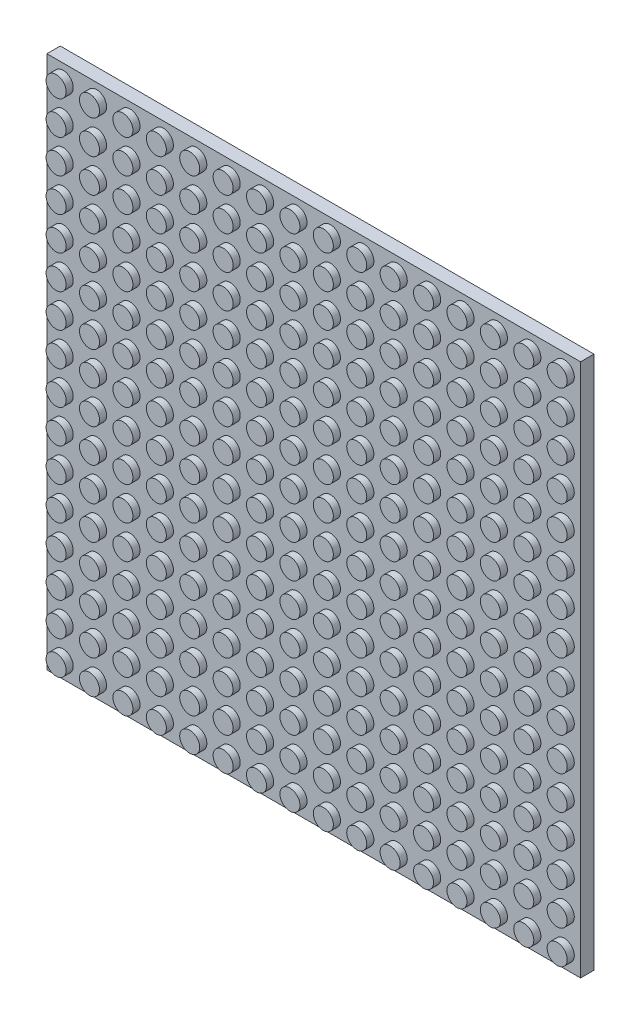
from build123d import *

# Parameters (mm, degrees)
SKETCH_1_W          = 127.8
SKETCH_1_H          = 127.8
EXTRUDE_1_DEPTH     = 3.2
SKETCH_2_R          = 2.4
EXTRUDE_2_DEPTH     = 1.7
SKETCH_5_R          = 2.5
CUT_EXTRUDE_1_DEPTH = 1.8


with BuildPart() as part:
    # Эскиз1 → Бобышка-Вытянуть1 (new body)
    with BuildSketch(Plane.XY):
        Rectangle(SKETCH_1_W, SKETCH_1_H)
    extrude(amount=EXTRUDE_1_DEPTH)

    # Эскиз2 → Бобышка-Вытянуть2 (add)
    with BuildSketch(Plane.XY.offset(3.2)):
        with Locations((-60, 60)):
            Circle(SKETCH_2_R)
        with Locations((-52, 60)):
            Circle(SKETCH_2_R)
        with Locations((-44, 60)):
            Circle(SKETCH_2_R)
        with Locations((-36, 60)):
            Circle(SKETCH_2_R)
        with Locations((-28, 60)):
            Circle(SKETCH_2_R)
        with Locations((-20, 60)):
            Circle(SKETCH_2_R)
        with Locations((-12, 60)):
            Circle(SKETCH_2_R)
        with Locations((-4, 60)):
            Circle(SKETCH_2_R)
        with Locations((4, 60)):
            Circle(SKETCH_2_R)
        with Locations((12, 60)):
            Circle(SKETCH_2_R)
        with Locations((20, 60)):
            Circle(SKETCH_2_R)
        with Locations((28, 60)):
            Circle(SKETCH_2_R)
        with Locations((36, 60)):
            Circle(SKETCH_2_R)
        with Locations((44, 60)):
            Circle(SKETCH_2_R)
        with Locations((52, 60)):
            Circle(SKETCH_2_R)
        with Locations((60, 60)):
            Circle(SKETCH_2_R)
        with Locations((-52, 52)):
            Circle(SKETCH_2_R)
        with Locations((-44, 52)):
            Circle(SKETCH_2_R)
        with Locations((-36, 52)):
            Circle(SKETCH_2_R)
        with Locations((-28, 52)):
            Circle(SKETCH_2_R)
        with Locations((-20, 52)):
            Circle(SKETCH_2_R)
        with Locations((-12, 52)):
            Circle(SKETCH_2_R)
        with Locations((-4, 52)):
            Circle(SKETCH_2_R)
        with Locations((4, 52)):
            Circle(SKETCH_2_R)
        with Locations((12, 52)):
            Circle(SKETCH_2_R)
        with Locations((20, 52)):
            Circle(SKETCH_2_R)
        with Locations((28, 52)):
            Circle(SKETCH_2_R)
        with Locations((36, 52)):
            Circle(SKETCH_2_R)
        with Locations((44, 52)):
            Circle(SKETCH_2_R)
        with Locations((52, 52)):
            Circle(SKETCH_2_R)
        with Locations((60, 52)):
            Circle(SKETCH_2_R)
        with Locations((-52, 44)):
            Circle(SKETCH_2_R)
        with Locations((-44, 44)):
            Circle(SKETCH_2_R)
        with Locations((-36, 44)):
            Circle(SKETCH_2_R)
        with Locations((-28, 44)):
            Circle(SKETCH_2_R)
        with Locations((-20, 44)):
            Circle(SKETCH_2_R)
        with Locations((-12, 44)):
            Circle(SKETCH_2_R)
        with Locations((-4, 44)):
            Circle(SKETCH_2_R)
        with Locations((4, 44)):
            Circle(SKETCH_2_R)
        with Locations((12, 44)):
            Circle(SKETCH_2_R)
        with Locations((20, 44)):
            Circle(SKETCH_2_R)
        with Locations((28, 44)):
            Circle(SKETCH_2_R)
        with Locations((36, 44)):
            Circle(SKETCH_2_R)
        with Locations((44, 44)):
            Circle(SKETCH_2_R)
        with Locations((52, 44)):
            Circle(SKETCH_2_R)
        with Locations((60, 44)):
            Circle(SKETCH_2_R)
        with Locations((-52, 36)):
            Circle(SKETCH_2_R)
        with Locations((-44, 36)):
            Circle(SKETCH_2_R)
        with Locations((-36, 36)):
            Circle(SKETCH_2_R)
        with Locations((-28, 36)):
            Circle(SKETCH_2_R)
        with Locations((-20, 36)):
            Circle(SKETCH_2_R)
        with Locations((-12, 36)):
            Circle(SKETCH_2_R)
        with Locations((-4, 36)):
            Circle(SKETCH_2_R)
        with Locations((4, 36)):
            Circle(SKETCH_2_R)
        with Locations((12, 36)):
            Circle(SKETCH_2_R)
        with Locations((20, 36)):
            Circle(SKETCH_2_R)
        with Locations((28, 36)):
            Circle(SKETCH_2_R)
        with Locations((36, 36)):
            Circle(SKETCH_2_R)
        with Locations((44, 36)):
            Circle(SKETCH_2_R)
        with Locations((52, 36)):
            Circle(SKETCH_2_R)
        with Locations((60, 36)):
            Circle(SKETCH_2_R)
        with Locations((-52, 28)):
            Circle(SKETCH_2_R)
        with Locations((-44, 28)):
            Circle(SKETCH_2_R)
        with Locations((-36, 28)):
            Circle(SKETCH_2_R)
        with Locations((-28, 28)):
            Circle(SKETCH_2_R)
        with Locations((-20, 28)):
            Circle(SKETCH_2_R)
        with Locations((-12, 28)):
            Circle(SKETCH_2_R)
        with Locations((-4, 28)):
            Circle(SKETCH_2_R)
        with Locations((4, 28)):
            Circle(SKETCH_2_R)
        with Locations((12, 28)):
            Circle(SKETCH_2_R)
        with Locations((20, 28)):
            Circle(SKETCH_2_R)
        with Locations((28, 28)):
            Circle(SKETCH_2_R)
        with Locations((36, 28)):
            Circle(SKETCH_2_R)
        with Locations((44, 28)):
            Circle(SKETCH_2_R)
        with Locations((52, 28)):
            Circle(SKETCH_2_R)
        with Locations((60, 28)):
            Circle(SKETCH_2_R)
        with Locations((-52, 20)):
            Circle(SKETCH_2_R)
        with Locations((-44, 20)):
            Circle(SKETCH_2_R)
        with Locations((-36, 20)):
            Circle(SKETCH_2_R)
        with Locations((-28, 20)):
            Circle(SKETCH_2_R)
        with Locations((-20, 20)):
            Circle(SKETCH_2_R)
        with Locations((-12, 20)):
            Circle(SKETCH_2_R)
        with Locations((-4, 20)):
            Circle(SKETCH_2_R)
        with Locations((4, 20)):
            Circle(SKETCH_2_R)
        with Locations((12, 20)):
            Circle(SKETCH_2_R)
        with Locations((20, 20)):
            Circle(SKETCH_2_R)
        with Locations((28, 20)):
            Circle(SKETCH_2_R)
        with Locations((36, 20)):
            Circle(SKETCH_2_R)
        with Locations((44, 20)):
            Circle(SKETCH_2_R)
        with Locations((52, 20)):
            Circle(SKETCH_2_R)
        with Locations((60, 20)):
            Circle(SKETCH_2_R)
        with Locations((-52, 12)):
            Circle(SKETCH_2_R)
        with Locations((-44, 12)):
            Circle(SKETCH_2_R)
        with Locations((-36, 12)):
            Circle(SKETCH_2_R)
        with Locations((-28, 12)):
            Circle(SKETCH_2_R)
        with Locations((-20, 12)):
            Circle(SKETCH_2_R)
        with Locations((-12, 12)):
            Circle(SKETCH_2_R)
        with Locations((-4, 12)):
            Circle(SKETCH_2_R)
        with Locations((4, 12)):
            Circle(SKETCH_2_R)
        with Locations((12, 12)):
            Circle(SKETCH_2_R)
        with Locations((20, 12)):
            Circle(SKETCH_2_R)
        with Locations((28, 12)):
            Circle(SKETCH_2_R)
        with Locations((36, 12)):
            Circle(SKETCH_2_R)
        with Locations((44, 12)):
            Circle(SKETCH_2_R)
        with Locations((52, 12)):
            Circle(SKETCH_2_R)
        with Locations((60, 12)):
            Circle(SKETCH_2_R)
        with Locations((-52, 4)):
            Circle(SKETCH_2_R)
        with Locations((-44, 4)):
            Circle(SKETCH_2_R)
        with Locations((-36, 4)):
            Circle(SKETCH_2_R)
        with Locations((-28, 4)):
            Circle(SKETCH_2_R)
        with Locations((-20, 4)):
            Circle(SKETCH_2_R)
        with Locations((-12, 4)):
            Circle(SKETCH_2_R)
        with Locations((-4, 4)):
            Circle(SKETCH_2_R)
        with Locations((4, 4)):
            Circle(SKETCH_2_R)
        with Locations((12, 4)):
            Circle(SKETCH_2_R)
        with Locations((20, 4)):
            Circle(SKETCH_2_R)
        with Locations((28, 4)):
            Circle(SKETCH_2_R)
        with Locations((36, 4)):
            Circle(SKETCH_2_R)
        with Locations((44, 4)):
            Circle(SKETCH_2_R)
        with Locations((52, 4)):
            Circle(SKETCH_2_R)
        with Locations((60, 4)):
            Circle(SKETCH_2_R)
        with Locations((-52, -4)):
            Circle(SKETCH_2_R)
        with Locations((-44, -4)):
            Circle(SKETCH_2_R)
        with Locations((-36, -4)):
            Circle(SKETCH_2_R)
        with Locations((-28, -4)):
            Circle(SKETCH_2_R)
        with Locations((-20, -4)):
            Circle(SKETCH_2_R)
        with Locations((-12, -4)):
            Circle(SKETCH_2_R)
        with Locations((-4, -4)):
            Circle(SKETCH_2_R)
        with Locations((4, -4)):
            Circle(SKETCH_2_R)
        with Locations((12, -4)):
            Circle(SKETCH_2_R)
        with Locations((20, -4)):
            Circle(SKETCH_2_R)
        with Locations((28, -4)):
            Circle(SKETCH_2_R)
        with Locations((36, -4)):
            Circle(SKETCH_2_R)
        with Locations((44, -4)):
            Circle(SKETCH_2_R)
        with Locations((52, -4)):
            Circle(SKETCH_2_R)
        with Locations((60, -4)):
            Circle(SKETCH_2_R)
        with Locations((-52, -12)):
            Circle(SKETCH_2_R)
        with Locations((-44, -12)):
            Circle(SKETCH_2_R)
        with Locations((-36, -12)):
            Circle(SKETCH_2_R)
        with Locations((-28, -12)):
            Circle(SKETCH_2_R)
        with Locations((-20, -12)):
            Circle(SKETCH_2_R)
        with Locations((-12, -12)):
            Circle(SKETCH_2_R)
        with Locations((-4, -12)):
            Circle(SKETCH_2_R)
        with Locations((4, -12)):
            Circle(SKETCH_2_R)
        with Locations((12, -12)):
            Circle(SKETCH_2_R)
        with Locations((20, -12)):
            Circle(SKETCH_2_R)
        with Locations((28, -12)):
            Circle(SKETCH_2_R)
        with Locations((36, -12)):
            Circle(SKETCH_2_R)
        with Locations((44, -12)):
            Circle(SKETCH_2_R)
        with Locations((52, -12)):
            Circle(SKETCH_2_R)
        with Locations((60, -12)):
            Circle(SKETCH_2_R)
        with Locations((-52, -20)):
            Circle(SKETCH_2_R)
        with Locations((-44, -20)):
            Circle(SKETCH_2_R)
        with Locations((-36, -20)):
            Circle(SKETCH_2_R)
        with Locations((-28, -20)):
            Circle(SKETCH_2_R)
        with Locations((-20, -20)):
            Circle(SKETCH_2_R)
        with Locations((-12, -20)):
            Circle(SKETCH_2_R)
        with Locations((-4, -20)):
            Circle(SKETCH_2_R)
        with Locations((4, -20)):
            Circle(SKETCH_2_R)
        with Locations((12, -20)):
            Circle(SKETCH_2_R)
        with Locations((20, -20)):
            Circle(SKETCH_2_R)
        with Locations((28, -20)):
            Circle(SKETCH_2_R)
        with Locations((36, -20)):
            Circle(SKETCH_2_R)
        with Locations((44, -20)):
            Circle(SKETCH_2_R)
        with Locations((52, -20)):
            Circle(SKETCH_2_R)
        with Locations((60, -20)):
            Circle(SKETCH_2_R)
        with Locations((-52, -28)):
            Circle(SKETCH_2_R)
        with Locations((-44, -28)):
            Circle(SKETCH_2_R)
        with Locations((-36, -28)):
            Circle(SKETCH_2_R)
        with Locations((-28, -28)):
            Circle(SKETCH_2_R)
        with Locations((-20, -28)):
            Circle(SKETCH_2_R)
        with Locations((-12, -28)):
            Circle(SKETCH_2_R)
        with Locations((-4, -28)):
            Circle(SKETCH_2_R)
        with Locations((4, -28)):
            Circle(SKETCH_2_R)
        with Locations((12, -28)):
            Circle(SKETCH_2_R)
        with Locations((20, -28)):
            Circle(SKETCH_2_R)
        with Locations((28, -28)):
            Circle(SKETCH_2_R)
        with Locations((36, -28)):
            Circle(SKETCH_2_R)
        with Locations((44, -28)):
            Circle(SKETCH_2_R)
        with Locations((52, -28)):
            Circle(SKETCH_2_R)
        with Locations((60, -28)):
            Circle(SKETCH_2_R)
        with Locations((-52, -36)):
            Circle(SKETCH_2_R)
        with Locations((-44, -36)):
            Circle(SKETCH_2_R)
        with Locations((-36, -36)):
            Circle(SKETCH_2_R)
        with Locations((-28, -36)):
            Circle(SKETCH_2_R)
        with Locations((-20, -36)):
            Circle(SKETCH_2_R)
        with Locations((-12, -36)):
            Circle(SKETCH_2_R)
        with Locations((-4, -36)):
            Circle(SKETCH_2_R)
        with Locations((4, -36)):
            Circle(SKETCH_2_R)
        with Locations((12, -36)):
            Circle(SKETCH_2_R)
        with Locations((20, -36)):
            Circle(SKETCH_2_R)
        with Locations((28, -36)):
            Circle(SKETCH_2_R)
        with Locations((36, -36)):
            Circle(SKETCH_2_R)
        with Locations((44, -36)):
            Circle(SKETCH_2_R)
        with Locations((52, -36)):
            Circle(SKETCH_2_R)
        with Locations((60, -36)):
            Circle(SKETCH_2_R)
        with Locations((-52, -44)):
            Circle(SKETCH_2_R)
        with Locations((-44, -44)):
            Circle(SKETCH_2_R)
        with Locations((-36, -44)):
            Circle(SKETCH_2_R)
        with Locations((-28, -44)):
            Circle(SKETCH_2_R)
        with Locations((-20, -44)):
            Circle(SKETCH_2_R)
        with Locations((-12, -44)):
            Circle(SKETCH_2_R)
        with Locations((-4, -44)):
            Circle(SKETCH_2_R)
        with Locations((4, -44)):
            Circle(SKETCH_2_R)
        with Locations((12, -44)):
            Circle(SKETCH_2_R)
        with Locations((20, -44)):
            Circle(SKETCH_2_R)
        with Locations((28, -44)):
            Circle(SKETCH_2_R)
        with Locations((36, -44)):
            Circle(SKETCH_2_R)
        with Locations((44, -44)):
            Circle(SKETCH_2_R)
        with Locations((52, -44)):
            Circle(SKETCH_2_R)
        with Locations((60, -44)):
            Circle(SKETCH_2_R)
        with Locations((-52, -52)):
            Circle(SKETCH_2_R)
        with Locations((-44, -52)):
            Circle(SKETCH_2_R)
        with Locations((-36, -52)):
            Circle(SKETCH_2_R)
        with Locations((-28, -52)):
            Circle(SKETCH_2_R)
        with Locations((-20, -52)):
            Circle(SKETCH_2_R)
        with Locations((-12, -52)):
            Circle(SKETCH_2_R)
        with Locations((-4, -52)):
            Circle(SKETCH_2_R)
        with Locations((4, -52)):
            Circle(SKETCH_2_R)
        with Locations((12, -52)):
            Circle(SKETCH_2_R)
        with Locations((20, -52)):
            Circle(SKETCH_2_R)
        with Locations((28, -52)):
            Circle(SKETCH_2_R)
        with Locations((36, -52)):
            Circle(SKETCH_2_R)
        with Locations((44, -52)):
            Circle(SKETCH_2_R)
        with Locations((52, -52)):
            Circle(SKETCH_2_R)
        with Locations((60, -52)):
            Circle(SKETCH_2_R)
        with Locations((-52, -60)):
            Circle(SKETCH_2_R)
        with Locations((-44, -60)):
            Circle(SKETCH_2_R)
        with Locations((-36, -60)):
            Circle(SKETCH_2_R)
        with Locations((-28, -60)):
            Circle(SKETCH_2_R)
        with Locations((-20, -60)):
            Circle(SKETCH_2_R)
        with Locations((-12, -60)):
            Circle(SKETCH_2_R)
        with Locations((-4, -60)):
            Circle(SKETCH_2_R)
        with Locations((4, -60)):
            Circle(SKETCH_2_R)
        with Locations((12, -60)):
            Circle(SKETCH_2_R)
        with Locations((20, -60)):
            Circle(SKETCH_2_R)
        with Locations((28, -60)):
            Circle(SKETCH_2_R)
        with Locations((36, -60)):
            Circle(SKETCH_2_R)
        with Locations((44, -60)):
            Circle(SKETCH_2_R)
        with Locations((52, -60)):
            Circle(SKETCH_2_R)
        with Locations((60, -60)):
            Circle(SKETCH_2_R)
        with Locations((-60, 52)):
            Circle(SKETCH_2_R)
        with Locations((-60, 44)):
            Circle(SKETCH_2_R)
        with Locations((-60, 36)):
            Circle(SKETCH_2_R)
        with Locations((-60, 28)):
            Circle(SKETCH_2_R)
        with Locations((-60, 20)):
            Circle(SKETCH_2_R)
        with Locations((-60, 12)):
            Circle(SKETCH_2_R)
        with Locations((-60, 4)):
            Circle(SKETCH_2_R)
        with Locations((-60, -4)):
            Circle(SKETCH_2_R)
        with Locations((-60, -12)):
            Circle(SKETCH_2_R)
        with Locations((-60, -20)):
            Circle(SKETCH_2_R)
        with Locations((-60, -28)):
            Circle(SKETCH_2_R)
        with Locations((-60, -36)):
            Circle(SKETCH_2_R)
        with Locations((-60, -44)):
            Circle(SKETCH_2_R)
        with Locations((-60, -52)):
            Circle(SKETCH_2_R)
        with Locations((-60, -60)):
            Circle(SKETCH_2_R)
    extrude(amount=EXTRUDE_2_DEPTH)

    # Эскиз5 → Вырез-Вытянуть1 (cut)
    with BuildSketch(Plane(origin=(0, 0, 0), x_dir=(-1, 0, 0), z_dir=(0, 0, -1))):
        with Locations((-60, 60)):
            Circle(SKETCH_5_R)
        with Locations((-52, 60)):
            Circle(SKETCH_5_R)
        with Locations((-44, 60)):
            Circle(SKETCH_5_R)
        with Locations((-36, 60)):
            Circle(SKETCH_5_R)
        with Locations((-28, 60)):
            Circle(SKETCH_5_R)
        with Locations((-20, 60)):
            Circle(SKETCH_5_R)
        with Locations((-12, 60)):
            Circle(SKETCH_5_R)
        with Locations((-4, 60)):
            Circle(SKETCH_5_R)
        with Locations((4, 60)):
            Circle(SKETCH_5_R)
        with Locations((12, 60)):
            Circle(SKETCH_5_R)
        with Locations((20, 60)):
            Circle(SKETCH_5_R)
        with Locations((28, 60)):
            Circle(SKETCH_5_R)
        with Locations((36, 60)):
            Circle(SKETCH_5_R)
        with Locations((44, 60)):
            Circle(SKETCH_5_R)
        with Locations((52, 60)):
            Circle(SKETCH_5_R)
        with Locations((60, 60)):
            Circle(SKETCH_5_R)
        with Locations((-52, 52)):
            Circle(SKETCH_5_R)
        with Locations((-44, 52)):
            Circle(SKETCH_5_R)
        with Locations((-36, 52)):
            Circle(SKETCH_5_R)
        with Locations((-28, 52)):
            Circle(SKETCH_5_R)
        with Locations((-20, 52)):
            Circle(SKETCH_5_R)
        with Locations((-12, 52)):
            Circle(SKETCH_5_R)
        with Locations((-4, 52)):
            Circle(SKETCH_5_R)
        with Locations((4, 52)):
            Circle(SKETCH_5_R)
        with Locations((12, 52)):
            Circle(SKETCH_5_R)
        with Locations((20, 52)):
            Circle(SKETCH_5_R)
        with Locations((28, 52)):
            Circle(SKETCH_5_R)
        with Locations((36, 52)):
            Circle(SKETCH_5_R)
        with Locations((44, 52)):
            Circle(SKETCH_5_R)
        with Locations((52, 52)):
            Circle(SKETCH_5_R)
        with Locations((60, 52)):
            Circle(SKETCH_5_R)
        with Locations((-52, 44)):
            Circle(SKETCH_5_R)
        with Locations((-44, 44)):
            Circle(SKETCH_5_R)
        with Locations((-36, 44)):
            Circle(SKETCH_5_R)
        with Locations((-28, 44)):
            Circle(SKETCH_5_R)
        with Locations((-20, 44)):
            Circle(SKETCH_5_R)
        with Locations((-12, 44)):
            Circle(SKETCH_5_R)
        with Locations((-4, 44)):
            Circle(SKETCH_5_R)
        with Locations((4, 44)):
            Circle(SKETCH_5_R)
        with Locations((12, 44)):
            Circle(SKETCH_5_R)
        with Locations((20, 44)):
            Circle(SKETCH_5_R)
        with Locations((28, 44)):
            Circle(SKETCH_5_R)
        with Locations((36, 44)):
            Circle(SKETCH_5_R)
        with Locations((44, 44)):
            Circle(SKETCH_5_R)
        with Locations((52, 44)):
            Circle(SKETCH_5_R)
        with Locations((60, 44)):
            Circle(SKETCH_5_R)
        with Locations((-52, 36)):
            Circle(SKETCH_5_R)
        with Locations((-44, 36)):
            Circle(SKETCH_5_R)
        with Locations((-36, 36)):
            Circle(SKETCH_5_R)
        with Locations((-28, 36)):
            Circle(SKETCH_5_R)
        with Locations((-20, 36)):
            Circle(SKETCH_5_R)
        with Locations((-12, 36)):
            Circle(SKETCH_5_R)
        with Locations((-4, 36)):
            Circle(SKETCH_5_R)
        with Locations((4, 36)):
            Circle(SKETCH_5_R)
        with Locations((12, 36)):
            Circle(SKETCH_5_R)
        with Locations((20, 36)):
            Circle(SKETCH_5_R)
        with Locations((28, 36)):
            Circle(SKETCH_5_R)
        with Locations((36, 36)):
            Circle(SKETCH_5_R)
        with Locations((44, 36)):
            Circle(SKETCH_5_R)
        with Locations((52, 36)):
            Circle(SKETCH_5_R)
        with Locations((60, 36)):
            Circle(SKETCH_5_R)
        with Locations((-52, 28)):
            Circle(SKETCH_5_R)
        with Locations((-44, 28)):
            Circle(SKETCH_5_R)
        with Locations((-36, 28)):
            Circle(SKETCH_5_R)
        with Locations((-28, 28)):
            Circle(SKETCH_5_R)
        with Locations((-20, 28)):
            Circle(SKETCH_5_R)
        with Locations((-12, 28)):
            Circle(SKETCH_5_R)
        with Locations((-4, 28)):
            Circle(SKETCH_5_R)
        with Locations((4, 28)):
            Circle(SKETCH_5_R)
        with Locations((12, 28)):
            Circle(SKETCH_5_R)
        with Locations((20, 28)):
            Circle(SKETCH_5_R)
        with Locations((28, 28)):
            Circle(SKETCH_5_R)
        with Locations((36, 28)):
            Circle(SKETCH_5_R)
        with Locations((44, 28)):
            Circle(SKETCH_5_R)
        with Locations((52, 28)):
            Circle(SKETCH_5_R)
        with Locations((60, 28)):
            Circle(SKETCH_5_R)
        with Locations((-52, 20)):
            Circle(SKETCH_5_R)
        with Locations((-44, 20)):
            Circle(SKETCH_5_R)
        with Locations((-36, 20)):
            Circle(SKETCH_5_R)
        with Locations((-28, 20)):
            Circle(SKETCH_5_R)
        with Locations((-20, 20)):
            Circle(SKETCH_5_R)
        with Locations((-12, 20)):
            Circle(SKETCH_5_R)
        with Locations((-4, 20)):
            Circle(SKETCH_5_R)
        with Locations((4, 20)):
            Circle(SKETCH_5_R)
        with Locations((12, 20)):
            Circle(SKETCH_5_R)
        with Locations((20, 20)):
            Circle(SKETCH_5_R)
        with Locations((28, 20)):
            Circle(SKETCH_5_R)
        with Locations((36, 20)):
            Circle(SKETCH_5_R)
        with Locations((44, 20)):
            Circle(SKETCH_5_R)
        with Locations((52, 20)):
            Circle(SKETCH_5_R)
        with Locations((60, 20)):
            Circle(SKETCH_5_R)
        with Locations((-52, 12)):
            Circle(SKETCH_5_R)
        with Locations((-44, 12)):
            Circle(SKETCH_5_R)
        with Locations((-36, 12)):
            Circle(SKETCH_5_R)
        with Locations((-28, 12)):
            Circle(SKETCH_5_R)
        with Locations((-20, 12)):
            Circle(SKETCH_5_R)
        with Locations((-12, 12)):
            Circle(SKETCH_5_R)
        with Locations((-4, 12)):
            Circle(SKETCH_5_R)
        with Locations((4, 12)):
            Circle(SKETCH_5_R)
        with Locations((12, 12)):
            Circle(SKETCH_5_R)
        with Locations((20, 12)):
            Circle(SKETCH_5_R)
        with Locations((28, 12)):
            Circle(SKETCH_5_R)
        with Locations((36, 12)):
            Circle(SKETCH_5_R)
        with Locations((44, 12)):
            Circle(SKETCH_5_R)
        with Locations((52, 12)):
            Circle(SKETCH_5_R)
        with Locations((60, 12)):
            Circle(SKETCH_5_R)
        with Locations((-52, 4)):
            Circle(SKETCH_5_R)
        with Locations((-44, 4)):
            Circle(SKETCH_5_R)
        with Locations((-36, 4)):
            Circle(SKETCH_5_R)
        with Locations((-28, 4)):
            Circle(SKETCH_5_R)
        with Locations((-20, 4)):
            Circle(SKETCH_5_R)
        with Locations((-12, 4)):
            Circle(SKETCH_5_R)
        with Locations((-4, 4)):
            Circle(SKETCH_5_R)
        with Locations((4, 4)):
            Circle(SKETCH_5_R)
        with Locations((12, 4)):
            Circle(SKETCH_5_R)
        with Locations((20, 4)):
            Circle(SKETCH_5_R)
        with Locations((28, 4)):
            Circle(SKETCH_5_R)
        with Locations((36, 4)):
            Circle(SKETCH_5_R)
        with Locations((44, 4)):
            Circle(SKETCH_5_R)
        with Locations((52, 4)):
            Circle(SKETCH_5_R)
        with Locations((60, 4)):
            Circle(SKETCH_5_R)
        with Locations((-52, -4)):
            Circle(SKETCH_5_R)
        with Locations((-44, -4)):
            Circle(SKETCH_5_R)
        with Locations((-36, -4)):
            Circle(SKETCH_5_R)
        with Locations((-28, -4)):
            Circle(SKETCH_5_R)
        with Locations((-20, -4)):
            Circle(SKETCH_5_R)
        with Locations((-12, -4)):
            Circle(SKETCH_5_R)
        with Locations((-4, -4)):
            Circle(SKETCH_5_R)
        with Locations((4, -4)):
            Circle(SKETCH_5_R)
        with Locations((12, -4)):
            Circle(SKETCH_5_R)
        with Locations((20, -4)):
            Circle(SKETCH_5_R)
        with Locations((28, -4)):
            Circle(SKETCH_5_R)
        with Locations((36, -4)):
            Circle(SKETCH_5_R)
        with Locations((44, -4)):
            Circle(SKETCH_5_R)
        with Locations((52, -4)):
            Circle(SKETCH_5_R)
        with Locations((60, -4)):
            Circle(SKETCH_5_R)
        with Locations((-52, -12)):
            Circle(SKETCH_5_R)
        with Locations((-44, -12)):
            Circle(SKETCH_5_R)
        with Locations((-36, -12)):
            Circle(SKETCH_5_R)
        with Locations((-28, -12)):
            Circle(SKETCH_5_R)
        with Locations((-20, -12)):
            Circle(SKETCH_5_R)
        with Locations((-12, -12)):
            Circle(SKETCH_5_R)
        with Locations((-4, -12)):
            Circle(SKETCH_5_R)
        with Locations((4, -12)):
            Circle(SKETCH_5_R)
        with Locations((12, -12)):
            Circle(SKETCH_5_R)
        with Locations((20, -12)):
            Circle(SKETCH_5_R)
        with Locations((28, -12)):
            Circle(SKETCH_5_R)
        with Locations((36, -12)):
            Circle(SKETCH_5_R)
        with Locations((44, -12)):
            Circle(SKETCH_5_R)
        with Locations((52, -12)):
            Circle(SKETCH_5_R)
        with Locations((60, -12)):
            Circle(SKETCH_5_R)
        with Locations((-52, -20)):
            Circle(SKETCH_5_R)
        with Locations((-44, -20)):
            Circle(SKETCH_5_R)
        with Locations((-36, -20)):
            Circle(SKETCH_5_R)
        with Locations((-28, -20)):
            Circle(SKETCH_5_R)
        with Locations((-20, -20)):
            Circle(SKETCH_5_R)
        with Locations((-12, -20)):
            Circle(SKETCH_5_R)
        with Locations((-4, -20)):
            Circle(SKETCH_5_R)
        with Locations((4, -20)):
            Circle(SKETCH_5_R)
        with Locations((12, -20)):
            Circle(SKETCH_5_R)
        with Locations((20, -20)):
            Circle(SKETCH_5_R)
        with Locations((28, -20)):
            Circle(SKETCH_5_R)
        with Locations((36, -20)):
            Circle(SKETCH_5_R)
        with Locations((44, -20)):
            Circle(SKETCH_5_R)
        with Locations((52, -20)):
            Circle(SKETCH_5_R)
        with Locations((60, -20)):
            Circle(SKETCH_5_R)
        with Locations((-52, -28)):
            Circle(SKETCH_5_R)
        with Locations((-44, -28)):
            Circle(SKETCH_5_R)
        with Locations((-36, -28)):
            Circle(SKETCH_5_R)
        with Locations((-28, -28)):
            Circle(SKETCH_5_R)
        with Locations((-20, -28)):
            Circle(SKETCH_5_R)
        with Locations((-12, -28)):
            Circle(SKETCH_5_R)
        with Locations((-4, -28)):
            Circle(SKETCH_5_R)
        with Locations((4, -28)):
            Circle(SKETCH_5_R)
        with Locations((12, -28)):
            Circle(SKETCH_5_R)
        with Locations((20, -28)):
            Circle(SKETCH_5_R)
        with Locations((28, -28)):
            Circle(SKETCH_5_R)
        with Locations((36, -28)):
            Circle(SKETCH_5_R)
        with Locations((44, -28)):
            Circle(SKETCH_5_R)
        with Locations((52, -28)):
            Circle(SKETCH_5_R)
        with Locations((60, -28)):
            Circle(SKETCH_5_R)
        with Locations((-52, -36)):
            Circle(SKETCH_5_R)
        with Locations((-44, -36)):
            Circle(SKETCH_5_R)
        with Locations((-36, -36)):
            Circle(SKETCH_5_R)
        with Locations((-28, -36)):
            Circle(SKETCH_5_R)
        with Locations((-20, -36)):
            Circle(SKETCH_5_R)
        with Locations((-12, -36)):
            Circle(SKETCH_5_R)
        with Locations((-4, -36)):
            Circle(SKETCH_5_R)
        with Locations((4, -36)):
            Circle(SKETCH_5_R)
        with Locations((12, -36)):
            Circle(SKETCH_5_R)
        with Locations((20, -36)):
            Circle(SKETCH_5_R)
        with Locations((28, -36)):
            Circle(SKETCH_5_R)
        with Locations((36, -36)):
            Circle(SKETCH_5_R)
        with Locations((44, -36)):
            Circle(SKETCH_5_R)
        with Locations((52, -36)):
            Circle(SKETCH_5_R)
        with Locations((60, -36)):
            Circle(SKETCH_5_R)
        with Locations((-52, -44)):
            Circle(SKETCH_5_R)
        with Locations((-44, -44)):
            Circle(SKETCH_5_R)
        with Locations((-36, -44)):
            Circle(SKETCH_5_R)
        with Locations((-28, -44)):
            Circle(SKETCH_5_R)
        with Locations((-20, -44)):
            Circle(SKETCH_5_R)
        with Locations((-12, -44)):
            Circle(SKETCH_5_R)
        with Locations((-4, -44)):
            Circle(SKETCH_5_R)
        with Locations((4, -44)):
            Circle(SKETCH_5_R)
        with Locations((12, -44)):
            Circle(SKETCH_5_R)
        with Locations((20, -44)):
            Circle(SKETCH_5_R)
        with Locations((28, -44)):
            Circle(SKETCH_5_R)
        with Locations((36, -44)):
            Circle(SKETCH_5_R)
        with Locations((44, -44)):
            Circle(SKETCH_5_R)
        with Locations((52, -44)):
            Circle(SKETCH_5_R)
        with Locations((60, -44)):
            Circle(SKETCH_5_R)
        with Locations((-52, -52)):
            Circle(SKETCH_5_R)
        with Locations((-44, -52)):
            Circle(SKETCH_5_R)
        with Locations((-36, -52)):
            Circle(SKETCH_5_R)
        with Locations((-28, -52)):
            Circle(SKETCH_5_R)
        with Locations((-20, -52)):
            Circle(SKETCH_5_R)
        with Locations((-12, -52)):
            Circle(SKETCH_5_R)
        with Locations((-4, -52)):
            Circle(SKETCH_5_R)
        with Locations((4, -52)):
            Circle(SKETCH_5_R)
        with Locations((12, -52)):
            Circle(SKETCH_5_R)
        with Locations((20, -52)):
            Circle(SKETCH_5_R)
        with Locations((28, -52)):
            Circle(SKETCH_5_R)
        with Locations((36, -52)):
            Circle(SKETCH_5_R)
        with Locations((44, -52)):
            Circle(SKETCH_5_R)
        with Locations((52, -52)):
            Circle(SKETCH_5_R)
        with Locations((60, -52)):
            Circle(SKETCH_5_R)
        with Locations((-52, -60)):
            Circle(SKETCH_5_R)
        with Locations((-44, -60)):
            Circle(SKETCH_5_R)
        with Locations((-36, -60)):
            Circle(SKETCH_5_R)
        with Locations((-28, -60)):
            Circle(SKETCH_5_R)
        with Locations((-20, -60)):
            Circle(SKETCH_5_R)
        with Locations((-12, -60)):
            Circle(SKETCH_5_R)
        with Locations((-4, -60)):
            Circle(SKETCH_5_R)
        with Locations((4, -60)):
            Circle(SKETCH_5_R)
        with Locations((12, -60)):
            Circle(SKETCH_5_R)
        with Locations((20, -60)):
            Circle(SKETCH_5_R)
        with Locations((28, -60)):
            Circle(SKETCH_5_R)
        with Locations((36, -60)):
            Circle(SKETCH_5_R)
        with Locations((44, -60)):
            Circle(SKETCH_5_R)
        with Locations((52, -60)):
            Circle(SKETCH_5_R)
        with Locations((60, -60)):
            Circle(SKETCH_5_R)
        with Locations((-60, 52)):
            Circle(SKETCH_5_R)
        with Locations((-60, 44)):
            Circle(SKETCH_5_R)
        with Locations((-60, 36)):
            Circle(SKETCH_5_R)
        with Locations((-60, 28)):
            Circle(SKETCH_5_R)
        with Locations((-60, 20)):
            Circle(SKETCH_5_R)
        with Locations((-60, 12)):
            Circle(SKETCH_5_R)
        with Locations((-60, 4)):
            Circle(SKETCH_5_R)
        with Locations((-60, -4)):
            Circle(SKETCH_5_R)
        with Locations((-60, -12)):
            Circle(SKETCH_5_R)
        with Locations((-60, -20)):
            Circle(SKETCH_5_R)
        with Locations((-60, -28)):
            Circle(SKETCH_5_R)
        with Locations((-60, -36)):
            Circle(SKETCH_5_R)
        with Locations((-60, -44)):
            Circle(SKETCH_5_R)
        with Locations((-60, -52)):
            Circle(SKETCH_5_R)
        with Locations((-60, -60)):
            Circle(SKETCH_5_R)
    extrude(amount=-CUT_EXTRUDE_1_DEPTH, mode=Mode.SUBTRACT)


solid = part.part
